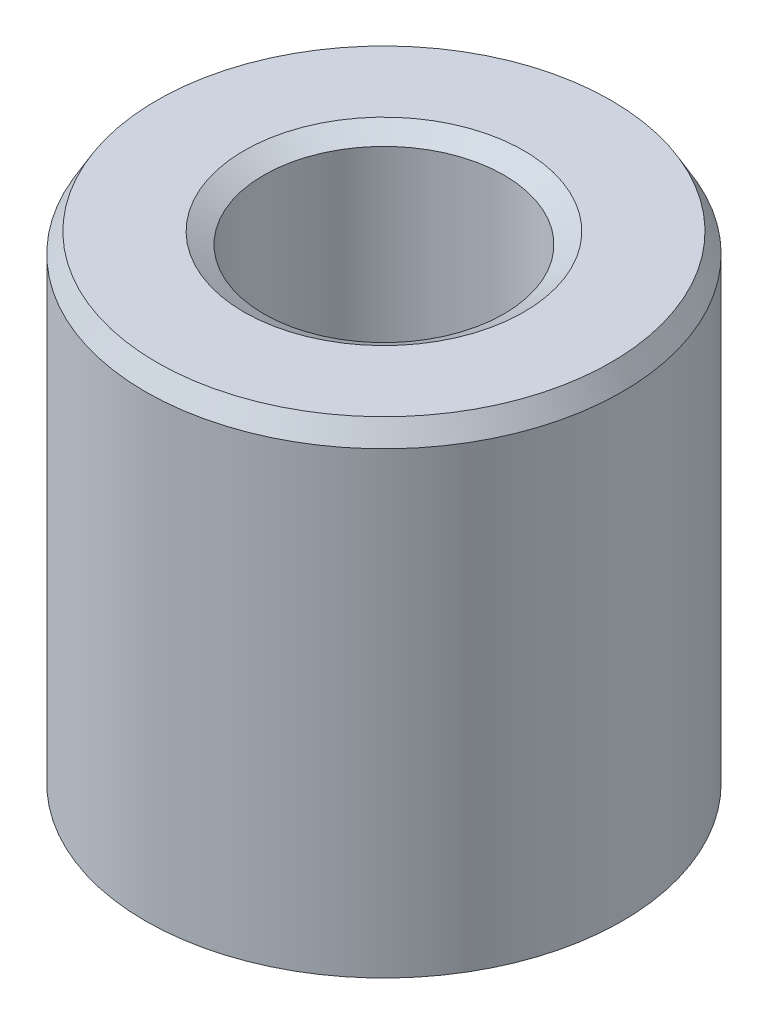
from build123d import *
from OCP.BRepFilletAPI import BRepFilletAPI_MakeChamfer

# Parameters (mm, degrees)
SKETCH1_R           = 22.5
BOSS_EXTRUDE1_DEPTH = 46.185385335
SKETCH2_R           = 11.341243101
CUT_EXTRUDE1_DEPTH  = 57.085558021
CHAMFER1_SIZE       = 1.860775823
CHAMFER1_SIZE2      = 1.074319422


with BuildPart() as part:
    # Sketch1 → Boss-Extrude1 (new body)
    with BuildSketch(Plane(origin=(0, 0, 0), x_dir=(1, 0, 0), z_dir=(0, 1, 0))):
        Circle(SKETCH1_R)
    extrude(amount=BOSS_EXTRUDE1_DEPTH)

    # Sketch2 → Cut-Extrude1 (cut, through all)
    with BuildSketch(Plane(origin=(0, 0, 0), x_dir=(1, 0, 0), z_dir=(0, 1, 0))):
        Circle(SKETCH2_R)
    extrude(amount=CUT_EXTRUDE1_DEPTH, mode=Mode.SUBTRACT)

    # Chamfer1: one chamfer whose edges measure the first distance from different faces: ONE call of the kernel's chamfer builder (chamfer() names one face for all edges)
    chamfer1_edges_1 = [part.edges().sort_by_distance(p)[0] for p in [
        (-11.341243101, 46.185385335, 0),
    ]]
    chamfer1_side_1 = [part.faces().sort_by_distance(p)[0] for p in [
        (-21.863603897, 46.185385335, 0),
    ]]
    chamfer1_edges_2 = [part.edges().sort_by_distance(p)[0] for p in [
        (-11.341243101, 0, 0),
    ]]
    chamfer1_side_2 = [part.faces().sort_by_distance(p)[0] for p in [
        (-11.341243101, 23.092692667, 0),
    ]]
    chamfer1_edges_3 = [part.edges().sort_by_distance(p)[0] for p in [
        (-22.5, 0, 0),
    ]]
    chamfer1_side_3 = [part.faces().sort_by_distance(p)[0] for p in [
        (-21.863603897, 0, 0),
    ]]
    chamfer1_edges_4 = [part.edges().sort_by_distance(p)[0] for p in [
        (-22.5, 46.185385335, 0),
    ]]
    chamfer1_side_4 = [part.faces().sort_by_distance(p)[0] for p in [
        (-22.5, 23.092692667, 0),
    ]]
    chamfer1 = BRepFilletAPI_MakeChamfer(part.part.solid().wrapped)
    for e in chamfer1_edges_1:
        chamfer1.Add(CHAMFER1_SIZE, CHAMFER1_SIZE2, e.wrapped, chamfer1_side_1[0].wrapped)  # the first distance lies on this face
    for e in chamfer1_edges_2:
        chamfer1.Add(CHAMFER1_SIZE, CHAMFER1_SIZE2, e.wrapped, chamfer1_side_2[0].wrapped)  # the first distance lies on this face
    for e in chamfer1_edges_3:
        chamfer1.Add(CHAMFER1_SIZE, CHAMFER1_SIZE2, e.wrapped, chamfer1_side_3[0].wrapped)  # the first distance lies on this face
    for e in chamfer1_edges_4:
        chamfer1.Add(CHAMFER1_SIZE, CHAMFER1_SIZE2, e.wrapped, chamfer1_side_4[0].wrapped)  # the first distance lies on this face
    add(Compound.cast(chamfer1.Shape()), mode=Mode.REPLACE)


solid = part.part
